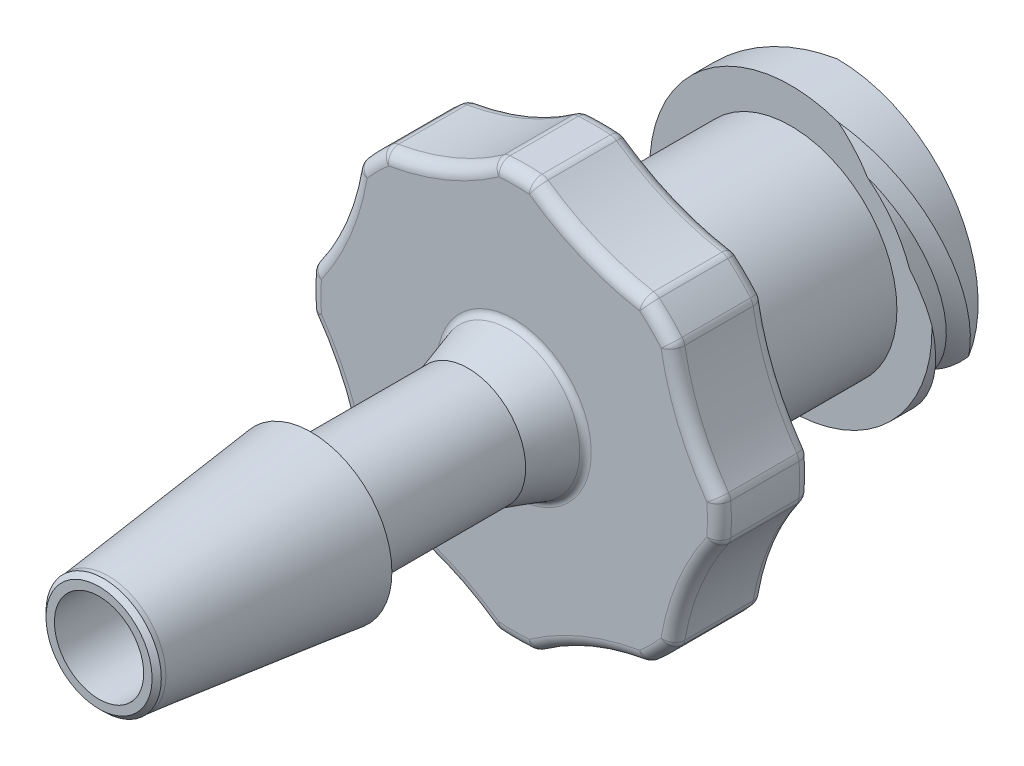
from build123d import *

# Parameters (mm, degrees)
CHAMFER1_SIZE      = 0.127
SKETCH8_R          = 7.1374
CUT_EXTRUDE2_DEPTH = 13.926890751
CIRPATTERN2_COUNT  = 8
FILLET2_R          = 0.3302
FILLET3_R          = 0.79375
FILLET4_R          = 0.1905
CUT_SWEEP1_PITCH   = 5
CIRPATTERN3_COUNT  = 2


with BuildPart() as part:
    # Sketch2 → Revolve1 (revolve)
    with BuildSketch(Plane(origin=(0, 0, 0), x_dir=(0, 0, -1), z_dir=(1, 0, 0)), mode=Mode.PRIVATE) as revolve1_sk:
        Polygon((1.27, 5.6515), (3.81, 5.6515), (3.81, 0), (1.27, 0), (-9.906, 0), (-10.16, 0), (-10.16, 1.5875), (-9.906, 1.5875), (-4.318, 2.2225), (-4.318, 1.5875), (0, 1.5875), (1.27, 1.984375), align=None)
    revolve(revolve1_sk.sketch.rotate(Axis((0, 0, 10.16), (0, 0, -1)), 90), axis=Axis((0, 0, 10.16), (0, 0, -1)))

    # Chamfer1
    chamfer1_edges = [part.edges().sort_by_distance(p)[0] for p in [
        (-1.5875, 0, 10.16),
    ]]
    chamfer(chamfer1_edges, length=CHAMFER1_SIZE)

    # Sketch4 → Revolve2 (revolve)
    with BuildSketch(Plane(origin=(0, 0, 0), x_dir=(0, 0, -1), z_dir=(1, 0, 0)), mode=Mode.PRIVATE) as revolve2_sk:
        Polygon((10.16, 0), (3.81, 0), (3.81, 2.921), (8.89, 2.921), (8.89, 3.8862), (10.16, 3.8862), align=None)
    revolve(revolve2_sk.sketch.rotate(Axis((0, 0, 10.16), (0, 0, -1)), 90), axis=Axis((0, 0, 10.16), (0, 0, -1)))

    # Sketch8 → Cut-Extrude2 (cut, symmetric)
    with BuildSketch(Plane.XY):
        with Locations((4.723997362, 11.404738501)):
            Circle(SKETCH8_R)
    cut_extrude2 = extrude(amount=CUT_EXTRUDE2_DEPTH, both=True, mode=Mode.SUBTRACT)

    # CirPattern2: Cut-Extrude2 ×8 about axis
    cirpattern2_axis = Axis((0, 0, 0), (0, 0, 1))
    for i in range(1, CIRPATTERN2_COUNT):
        add(cut_extrude2.rotate(cirpattern2_axis, i * 360 / CIRPATTERN2_COUNT), mode=Mode.SUBTRACT)

    # Fillet2
    fillet2_edges = [part.edges().sort_by_distance(p)[0] for p in [
        (0, 5.6515, -3.81),
        (1.992632632, 4.810640726, -3.81),
        (0, 5.6515, -1.27),
        (3.600215409, 4.356363307, -2.54),
        (1.992632632, 4.810640726, -1.27),
        (0.534677306, 5.626150765, -2.54),
        (-3.996213974, 3.996213974, -3.81),
        (-5.6515, 0, -3.81),
        (-3.996213974, -3.996213974, -3.81),
        (0, -5.6515, -3.81),
        (3.996213974, -3.996213974, -3.81),
        (5.6515, 0, -3.81),
        (3.996213974, 3.996213974, -3.81),
        (-3.996213974, 3.996213974, -1.27),
        (-5.6515, 0, -1.27),
        (-3.996213974, -3.996213974, -1.27),
        (0, -5.6515, -1.27),
        (3.996213974, -3.996213974, -1.27),
        (5.6515, 0, -1.27),
        (3.996213974, 3.996213974, -1.27),
        (-0.534677306, 5.626150765, -2.54),
        (-1.992632632, 4.810640726, -1.27),
        (-3.600215409, 4.356363307, -2.54),
        (-1.992632632, 4.810640726, -3.81),
        (-4.356363307, 3.600215409, -2.54),
        (-4.810640726, 1.992632632, -1.27),
        (-5.626150765, 0.534677306, -2.54),
        (-4.810640726, 1.992632632, -3.81),
        (-5.626150765, -0.534677306, -2.54),
        (-4.810640726, -1.992632632, -1.27),
        (-4.356363307, -3.600215409, -2.54),
        (-4.810640726, -1.992632632, -3.81),
        (-3.600215409, -4.356363307, -2.54),
        (-1.992632632, -4.810640726, -1.27),
        (-0.534677306, -5.626150765, -2.54),
        (-1.992632632, -4.810640726, -3.81),
        (0.534677306, -5.626150765, -2.54),
        (1.992632632, -4.810640726, -1.27),
        (3.600215409, -4.356363307, -2.54),
        (1.992632632, -4.810640726, -3.81),
        (4.356363307, -3.600215409, -2.54),
        (4.810640726, -1.992632632, -1.27),
        (5.626150765, -0.534677306, -2.54),
        (4.810640726, -1.992632632, -3.81),
        (5.626150765, 0.534677306, -2.54),
        (4.810640726, 1.992632632, -1.27),
        (4.356363307, 3.600215409, -2.54),
        (4.810640726, 1.992632632, -3.81),
    ]]
    fillet(fillet2_edges, radius=FILLET2_R)

    # Sketch9 → Cut-Revolve2 (revolve, cut)
    with BuildSketch(Plane(origin=(0, 0, 0), x_dir=(0, 0, -1), z_dir=(1, 0, 0)), mode=Mode.PRIVATE) as cut_revolve2_sk:
        Polygon((2.54, 2.025992405), (10.16, 2.159), (10.16, 0), (-10.16, 0), (-10.16, 1.228431221), (2.54, 1.1176), align=None)
    revolve(cut_revolve2_sk.sketch.rotate(Axis((0, 0, 10.16), (0, 0, -1)), 90), axis=Axis((0, 0, 10.16), (0, 0, -1)), mode=Mode.SUBTRACT)

    # Fillet3
    fillet3_edges = [part.edges().sort_by_distance(p)[0] for p in [
        (-2.921, 0, -3.81),
    ]]
    fillet(fillet3_edges, radius=FILLET3_R)

    # Fillet4
    fillet4_edges = [part.edges().sort_by_distance(p)[0] for p in [
        (-1.984375, 0, -1.27),
    ]]
    fillet(fillet4_edges, radius=FILLET4_R)

    # Cut-Sweep1: the profile of Sketch11 screwed along a right-hand helix of 0.635 turns, 12 arcs to a turn; built about Z, then put on its axis
    cut_sweep1_z = Axis((0, 0, 0), (0, 0, 1))
    cut_sweep1_corners = [(3.460365209, 0, -0.245855831), (3.460365209, 0, -0.70941254), (3.8862, 0, -0.955268371), (3.937, 0, -0.984597765), (3.937, 0, 0.029329394), (3.8862, 0, 0)]
    with BuildLine(mode=Mode.PRIVATE) as cut_sweep1_profile:
        Line(cut_sweep1_corners[0], cut_sweep1_corners[1])
        Line(cut_sweep1_corners[1], cut_sweep1_corners[2])
        Line(cut_sweep1_corners[2], cut_sweep1_corners[3])
        Line(cut_sweep1_corners[3], cut_sweep1_corners[4])
        Line(cut_sweep1_corners[4], cut_sweep1_corners[5])
        Line(cut_sweep1_corners[5], cut_sweep1_corners[0])
    cut_sweep1_cap = Face(cut_sweep1_profile.wire())
    cut_sweep1_turn_angles = [0, 15, 30, 45, 60, 75, 90, 105, 120, 135, 150, 165, 180, 195, 210, 219.3, 228.6]
    cut_sweep1_turn_weights = [1, 0.9659258262890683, 1, 0.9659258262890683, 1, 0.9659258262890683, 1, 0.9659258262890683, 1, 0.9659258262890683, 1, 0.9659258262890683, 1, 0.9659258262890683, 1, 0.9868557164068067, 1]
    cut_sweep1_turn_rails = [Edge.make_bspline([Vector(p[0], p[1], 0).rotate(cut_sweep1_z, cut_sweep1_turn_angles[k]) / cut_sweep1_turn_weights[k] + Vector(0, 0, p[2] + CUT_SWEEP1_PITCH * cut_sweep1_turn_angles[k] / 360) for k in range(17)], [0, 0, 0, 1, 1, 2, 2, 3, 3, 4, 4, 5, 5, 6, 6, 7, 7, 8, 8, 8], 2, cut_sweep1_turn_weights) for p in cut_sweep1_corners]
    cut_sweep1_turn_sides = [Face.make_surface_from_curves(cut_sweep1_turn_rails[p[0]], cut_sweep1_turn_rails[p[1]]) for p in [(0, 1), (1, 2), (2, 3), (3, 4), (4, 5), (5, 0)]]
    cut_sweep1 = Plane(origin=(0, 0, -10.16), x_dir=(0, 1, 0), z_dir=(0, 0, 1)) * Solid(Shell([*cut_sweep1_turn_sides, cut_sweep1_cap, cut_sweep1_cap.rotate(cut_sweep1_z, 228.6).moved(Location((0, 0, CUT_SWEEP1_PITCH * 228.6 / 360)))]))
    add(cut_sweep1, mode=Mode.SUBTRACT)

    # CirPattern3: Cut-Sweep1 ×2 about axis
    cirpattern3_axis = Axis((0, 0, 10.16), (0, 0, -1))
    for i in range(1, CIRPATTERN3_COUNT):
        add(cut_sweep1.rotate(cirpattern3_axis, i * 360 / CIRPATTERN3_COUNT), mode=Mode.SUBTRACT)


solid = part.part
